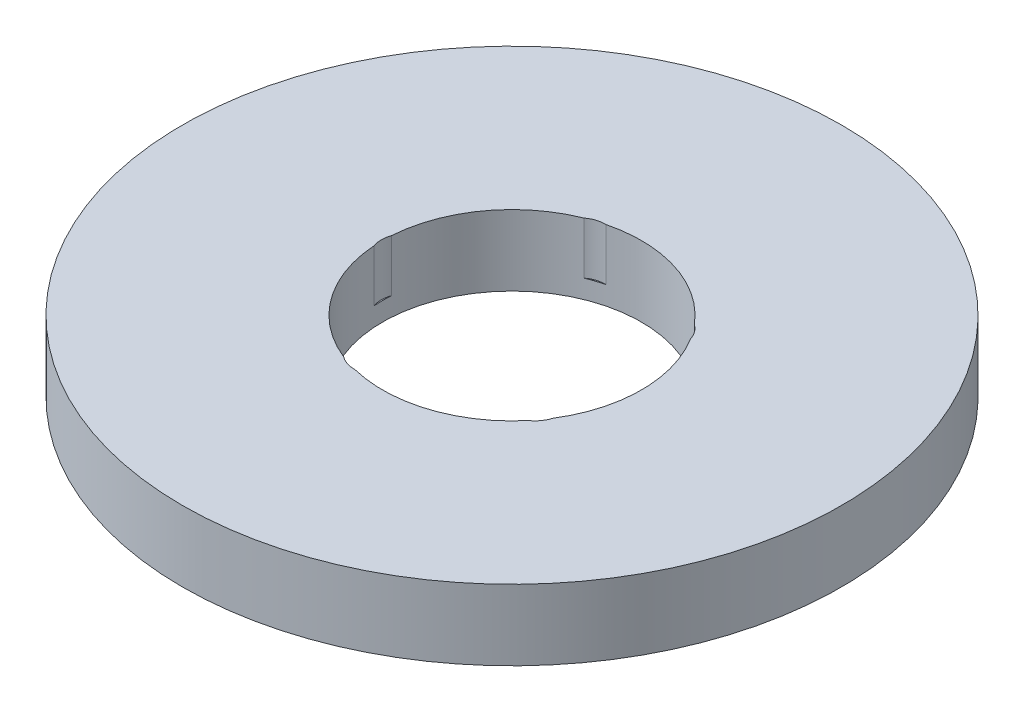
from build123d import *

# Parameters (mm, degrees)
SKETCH1_R           = 70
BOSS_EXTRUDE1_DEPTH = 15
SKETCH2_R           = 27.5
CUT_EXTRUDE1_DEPTH  = 101.124921973
SKETCH3_R           = 5.642707135
CUT_EXTRUDE2_DEPTH  = 11.048522985
CIRPATTERN1_COUNT   = 5


with BuildPart() as part:
    # Sketch1 → Boss-Extrude1 (new body)
    with BuildSketch(Plane(origin=(0, 0, 0), x_dir=(1, 0, 0), z_dir=(0, 1, 0))):
        Circle(SKETCH1_R)
    extrude(amount=BOSS_EXTRUDE1_DEPTH)

    # Sketch2 → Cut-Extrude1 (cut, through all)
    with BuildSketch(Plane(origin=(0, 0, 0), x_dir=(1, 0, 0), z_dir=(0, 1, 0))):
        Circle(SKETCH2_R)
    extrude(amount=CUT_EXTRUDE1_DEPTH, mode=Mode.SUBTRACT)

    # Sketch3 → Cut-Extrude2 (cut)
    with BuildSketch(Plane(origin=(0, 15, 0), x_dir=(1, 0, 0), z_dir=(0, 1, 0))):
        with Locations((-22.112102832, 0)):
            Circle(SKETCH3_R)
    cut_extrude2 = extrude(amount=-CUT_EXTRUDE2_DEPTH, mode=Mode.SUBTRACT)

    # CirPattern1: Cut-Extrude2 ×5 about axis
    cirpattern1_axis = Axis((0, 0, 0), (0, 1, 0))
    for i in range(1, CIRPATTERN1_COUNT):
        add(cut_extrude2.rotate(cirpattern1_axis, i * 360 / CIRPATTERN1_COUNT), mode=Mode.SUBTRACT)


solid = part.part
